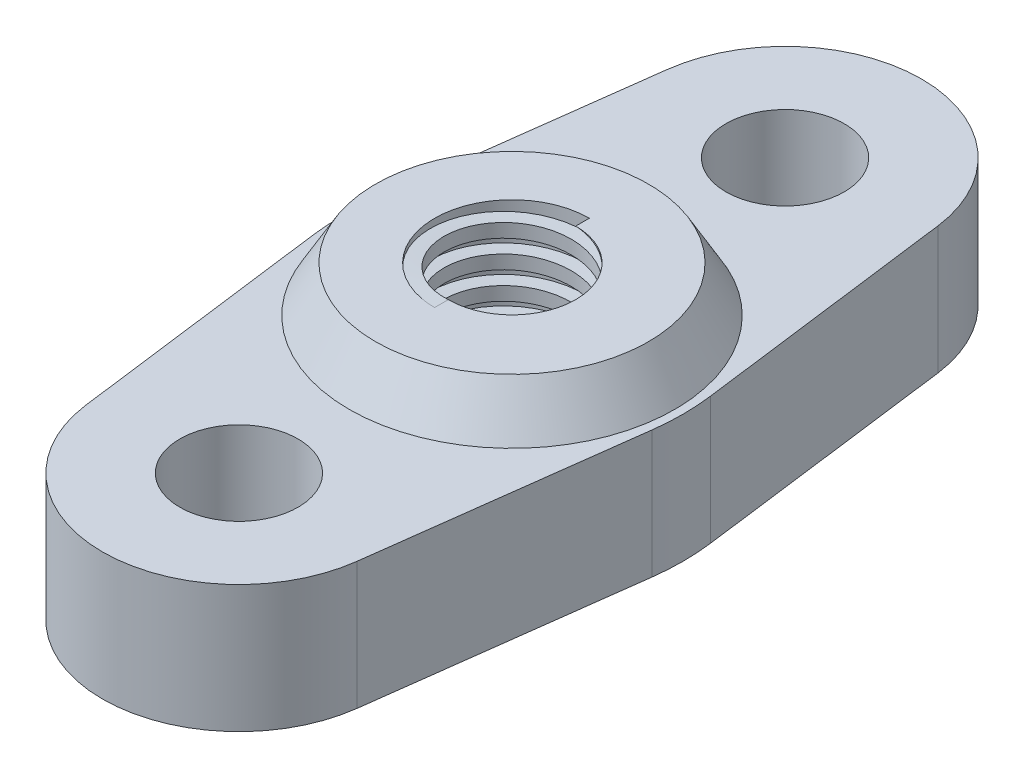
from build123d import *

# Parameters (mm, degrees)
SKETCH4_R          = 13
CUT_EXTRUDE1_DEPTH = 131.322676461
FILLET1_R          = 50
CUT_SWEEP1_PITCH   = 6


with BuildPart() as part:
    # Sketch3 → Revolve1 (revolve)
    with BuildSketch(Plane.XY, mode=Mode.PRIVATE) as revolve1_sk:
        Polygon((14, 38), (14, 0), (90, 0), (90, 28), (35.773502692, 28), (30, 38), align=None)
    revolve(revolve1_sk.sketch.rotate(Axis((0, 60.677130999, 0), (0, -1, 0)), 90), axis=Axis((0, 60.677130999, 0), (0, -1, 0)))

    # Sketch4 → Cut-Extrude1 (cut, through all)
    with BuildSketch(Plane(origin=(0, 28, 0), x_dir=(1, 0, 0), z_dir=(0, 1, 0))):
        with BuildLine():
            Line((-38, 0), (-29.752782308, 63.843428795))
            ThreePointArc((-29.752782308, 63.843428795), (-19.807790478, 82.531121507), (2.98e-07, 90))
            ThreePointArc((2.98e-07, 90), (-90, 1.2e-07), (5.7e-08, -90))
            ThreePointArc((5.7e-08, -90), (-19.807790569, -82.531121427), (-29.752782308, -63.843428795))
            Line((-29.752782308, -63.843428795), (-38, 0))
        make_face()
        with BuildLine():
            ThreePointArc((90, 0), (63.639610412, 63.639610202), (2.98e-07, 90))
            ThreePointArc((2.98e-07, 90), (19.807790702, 82.53112131), (29.752782308, 63.843428795))
            Line((29.752782308, 63.843428795), (38, 0))
            Line((38, 0), (29.752782308, -63.843428795))
            ThreePointArc((29.752782308, -63.843428795), (19.807790612, -82.53112139), (5.7e-08, -90))
            ThreePointArc((5.7e-08, -90), (63.639610327, -63.639610287), (90, 0))
        make_face()
        with Locations(Location((0, -60, 0), (0, 0, 270))):
            Circle(SKETCH4_R)
        with Locations(Location((0, 60, 0), (0, 0, 270))):
            Circle(SKETCH4_R)
    extrude(amount=-CUT_EXTRUDE1_DEPTH, mode=Mode.SUBTRACT)

    # Fillet1
    fillet1_edges = [part.edges().sort_by_distance(p)[0] for p in [
        (-38, 14, 0),
        (38, 14, 0),
    ]]
    fillet(fillet1_edges, radius=FILLET1_R)

    # Cut-Sweep1: arcs per turn and ends read off the stored shape
    # Cut-Sweep1: the profile of Sketch6 profile screwed along a right-hand helix through 8.333333 turns, 14 arcs to a turn; built about Z, then put on its axis
    cut_sweep1_z = Axis((0, 0, 0), (0, 0, 1))
    cut_sweep1_corners = [(17, 0, -3), (13.9997, 0, -3), (13.9997, 0, 0), (17, 0, 0)]
    with BuildLine(mode=Mode.PRIVATE) as cut_sweep1_profile:
        Line(cut_sweep1_corners[0], cut_sweep1_corners[1])
        Line(cut_sweep1_corners[1], cut_sweep1_corners[2])
        Line(cut_sweep1_corners[2], cut_sweep1_corners[3])
        Line(cut_sweep1_corners[3], cut_sweep1_corners[0])
    cut_sweep1_cap = Face(cut_sweep1_profile.wire())
    cut_sweep1_turn_angles = [0, 12.857142857, 25.714285714, 38.571428571, 51.428571429, 64.285714286, 77.142857143, 90, 102.857142857, 115.714285714, 128.571428571, 141.428571429, 154.285714286, 167.142857143, 180, 192.857142857, 205.714285714, 218.571428571, 231.428571429, 244.285714286, 257.142857143, 270, 282.857142857, 295.714285714, 308.571428571, 321.428571429, 334.285714286, 347.142857143, 360]
    cut_sweep1_turn_weights = [1, 0.9749279121818236, 1, 0.9749279121818236, 1, 0.9749279121818236, 1, 0.9749279121818236, 1, 0.9749279121818236, 1, 0.9749279121818236, 1, 0.9749279121818236, 1, 0.9749279121818236, 1, 0.9749279121818236, 1, 0.9749279121818236, 1, 0.9749279121818236, 1, 0.9749279121818237, 1, 0.9749279121818236, 1, 0.9749279121818236, 1]
    cut_sweep1_turn_rails = [Edge.make_bspline([Vector(p[0], p[1], 0).rotate(cut_sweep1_z, cut_sweep1_turn_angles[k]) / cut_sweep1_turn_weights[k] + Vector(0, 0, p[2] + CUT_SWEEP1_PITCH * cut_sweep1_turn_angles[k] / 360) for k in range(29)], [0, 0, 0, 1, 1, 2, 2, 3, 3, 4, 4, 5, 5, 6, 6, 7, 7, 8, 8, 9, 9, 10, 10, 11, 11, 12, 12, 13, 13, 14, 14, 14], 2, cut_sweep1_turn_weights) for p in cut_sweep1_corners]
    cut_sweep1_turn_sides = [Face.make_surface_from_curves(cut_sweep1_turn_rails[p[0]], cut_sweep1_turn_rails[p[1]]) for p in [(0, 1), (1, 2), (2, 3), (3, 0)]]
    cut_sweep1_last_angles = [2880, 2892.857142857, 2905.714285714, 2918.571428571, 2931.428571429, 2944.285714286, 2957.142857143, 2970, 2982.857142857, 2991.428571429, 3000]
    cut_sweep1_last_weights = [1, 0.9749279121818235, 1, 0.9749279121818235, 1, 0.9749279121818235, 1, 0.9749279121818244, 1, 0.9888308262251247, 1]
    cut_sweep1_last_rails = [Edge.make_bspline([Vector(p[0], p[1], 0).rotate(cut_sweep1_z, cut_sweep1_last_angles[k]) / cut_sweep1_last_weights[k] + Vector(0, 0, p[2] + CUT_SWEEP1_PITCH * cut_sweep1_last_angles[k] / 360) for k in range(11)], [0, 0, 0, 1, 1, 2, 2, 3, 3, 4, 4, 5, 5, 5], 2, cut_sweep1_last_weights) for p in cut_sweep1_corners]
    cut_sweep1_last_sides = [Face.make_surface_from_curves(cut_sweep1_last_rails[p[0]], cut_sweep1_last_rails[p[1]]) for p in [(0, 1), (1, 2), (2, 3), (3, 0)]]
    cut_sweep1 = Plane(origin=(0, 38, 0), x_dir=(0, 0, 1), z_dir=(0, -1, 0)) * Solid(Shell([*[p.moved(Location((0, 0, CUT_SWEEP1_PITCH * i))) for i in range(8) for p in cut_sweep1_turn_sides], *cut_sweep1_last_sides, cut_sweep1_cap, cut_sweep1_cap.rotate(cut_sweep1_z, 3000).moved(Location((0, 0, CUT_SWEEP1_PITCH * 3000 / 360)))]))
    add(cut_sweep1, mode=Mode.SUBTRACT)


solid = part.part
